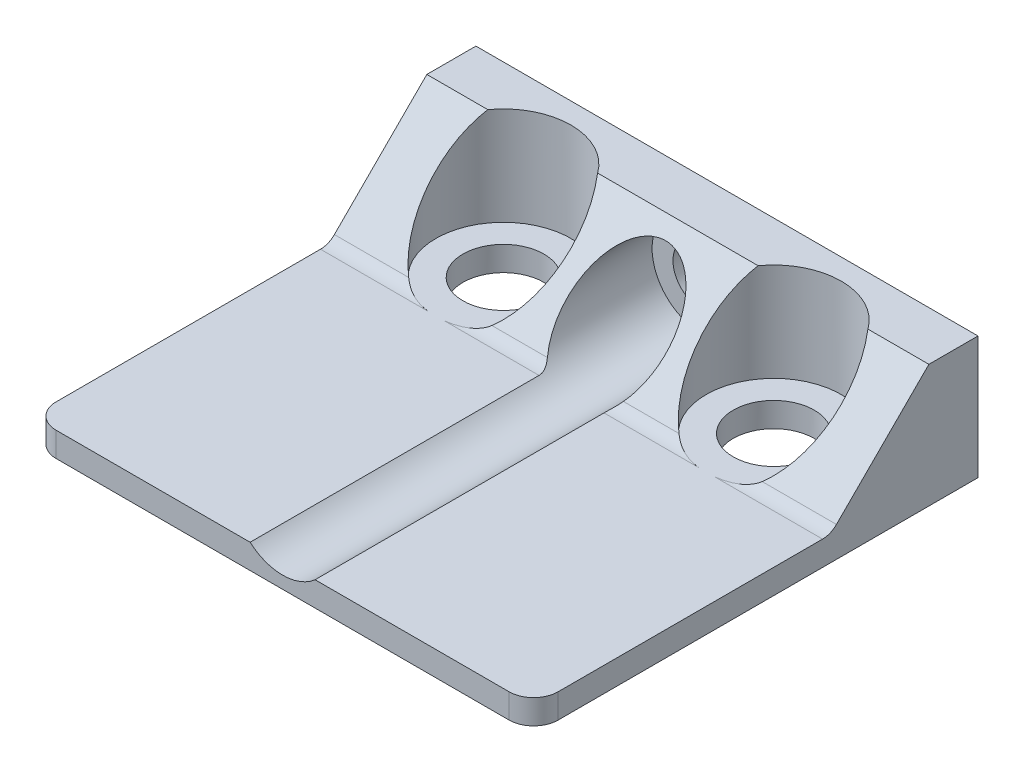
from build123d import *

# Parameters (mm, degrees)
SKETCH1_W                       = 20.45
SKETCH1_H                       = 18.1
BOSS_EXTRUDE2_DEPTH             = 1
BOSS_EXTRUDE3_REACH             = 15.691
BOSS_EXTRUDE3_DIRECTION_2_REACH = 15.691
SKETCH4_R                       = 1.65
CUT_EXTRUDE1_DEPTH              = 5
SKETCH6_R                       = 2.75
CUT_EXTRUDE2_DEPTH              = 4
SKETCH7_R                       = 1.15
CUT_EXTRUDE3_DEPTH              = 9.05
SKETCH8_R                       = 2
CUT_EXTRUDE4_DEPTH              = 8
CUT_EXTRUDE4_DIRECTION_2_REACH  = 16.541
FILLET2_R                       = 1
FILLET3_R                       = 0.8


with BuildPart() as part:
    # Sketch1 → Boss-Extrude2 (new body)
    with BuildSketch(Plane(origin=(0, 0, 0), x_dir=(1, 0, 0), z_dir=(0, 1, 0))):
        Rectangle(SKETCH1_W, SKETCH1_H)
    extrude(amount=BOSS_EXTRUDE2_DEPTH)

    # Boss-Extrude3: up to this face of the body (flat: up to its plane)
    boss_extrude3_end = Plane(part.part.faces().sort_by_distance((10.225, 0.5, 0))[0])
    # Sketch3 → Boss-Extrude3 (add, up to the picked face)
    with BuildSketch(Plane(origin=(0, 0, 0), x_dir=(0, 0, -1), z_dir=(1, 0, 0)), mode=Mode.PRIVATE) as boss_extrude3_sk1:
        Polygon((9.05, 1), (9.05, 5), (7.05, 5), (3.05, 1), align=None)
    boss_extrude3_tool1 = split(extrude(boss_extrude3_sk1.sketch, amount=BOSS_EXTRUDE3_REACH, mode=Mode.PRIVATE), bisect_by=boss_extrude3_end, keep=Keep.BOTH, mode=Mode.PRIVATE)
    add(boss_extrude3_tool1.solids().sort_by(Axis((0, 2.666667, -6.883333), (1, 0, 0)))[0])

    # Boss-Extrude3 direction 2: up to this face of the body (flat: up to its plane)
    boss_extrude3_direction_2_end = Plane(part.part.faces().sort_by_distance((-10.225, 0.5, 0))[0])
    # Sketch3 → Boss-Extrude3 direction 2 (add, up to the picked face)
    with BuildSketch(Plane(origin=(0, 0, 0), x_dir=(0, 0, -1), z_dir=(1, 0, 0)), mode=Mode.PRIVATE) as boss_extrude3_direction_2_sk1:
        Polygon((9.05, 1), (9.05, 5), (7.05, 5), (3.05, 1), align=None)
    boss_extrude3_direction_2_tool1 = split(extrude(boss_extrude3_direction_2_sk1.sketch, amount=-BOSS_EXTRUDE3_DIRECTION_2_REACH, mode=Mode.PRIVATE), bisect_by=boss_extrude3_direction_2_end, keep=Keep.BOTH, mode=Mode.PRIVATE)
    add(boss_extrude3_direction_2_tool1.solids().sort_by(Axis((0, 2.666667, -6.883333), (-1, 0, 0)))[0])

    # Sketch4 → Cut-Extrude1 (cut)
    with BuildSketch(Plane(origin=(0, 5, 0), x_dir=(1, 0, 0), z_dir=(0, 1, 0))):
        with Locations(Location((-5.505, 5.45, 0), (0, 0, 104.141110234))):
            Circle(SKETCH4_R)
        with Locations(Location((5.505, 5.45, 0), (0, 0, 75.858889766))):
            Circle(SKETCH4_R)
    extrude(amount=-CUT_EXTRUDE1_DEPTH, mode=Mode.SUBTRACT)

    # Sketch6 → Cut-Extrude2 (cut)
    with BuildSketch(Plane(origin=(0, 5, 0), x_dir=(1, 0, 0), z_dir=(0, 1, 0))):
        with Locations((-5.505, 5.45)):
            Circle(SKETCH6_R)
        with Locations((5.505, 5.45)):
            Circle(SKETCH6_R)
    extrude(amount=-CUT_EXTRUDE2_DEPTH, mode=Mode.SUBTRACT)

    # Sketch7 → Cut-Extrude3 (cut)
    with BuildSketch(Plane.XY):
        with Locations((0, 2.5)):
            Circle(SKETCH7_R)
    extrude(amount=-CUT_EXTRUDE3_DEPTH, mode=Mode.SUBTRACT)

    # Sketch8 → Cut-Extrude4 (cut)
    with BuildSketch(Plane.XY):
        with Locations(Location((0, 2.5, 0), (0, 0, 228.590377891))):
            Circle(SKETCH8_R)
    extrude(amount=-CUT_EXTRUDE4_DEPTH, mode=Mode.SUBTRACT)

    # Cut-Extrude4 direction 2: up to this face of the body (flat: up to its plane)
    cut_extrude4_direction_2_end = Plane(part.part.faces().sort_by_distance((0, 0.5, 9.05))[0])
    # Sketch8 → Cut-Extrude4 direction 2 (cut, up to the picked face)
    with BuildSketch(Plane.XY, mode=Mode.PRIVATE) as cut_extrude4_direction_2_sk1:
        with Locations(Location((0, 2.5, 0), (0, 0, 228.590377891))):
            Circle(SKETCH8_R)
    cut_extrude4_direction_2_tool1 = split(extrude(cut_extrude4_direction_2_sk1.sketch, amount=CUT_EXTRUDE4_DIRECTION_2_REACH, mode=Mode.PRIVATE), bisect_by=cut_extrude4_direction_2_end, keep=Keep.BOTH, mode=Mode.PRIVATE)
    add(cut_extrude4_direction_2_tool1.solids().sort_by(Axis((0, 2.5, 0), (0, 0, 1)))[0], mode=Mode.SUBTRACT)

    # Fillet2
    fillet2_edges = [part.edges().sort_by_distance(p)[0] for p in [
        (10.225, 0.5, 9.05),
        (-10.225, 0.5, 9.05),
    ]]
    fillet(fillet2_edges, radius=FILLET2_R)

    # Fillet3
    # the kernel refuses this fillet: 0.8 mm, written as the material it adds along each edge
    with BuildSketch(Plane(origin=(-6.019145033, 1, -3.05), x_dir=(0, 0, 1), z_dir=(-1, 0, 0))) as fillet3_piece_1_section:
        with BuildLine():
            CenterArc((FILLET3_R * 0.414213562373, FILLET3_R), FILLET3_R, 225, 45)
            Line((-FILLET3_R * 0.292893218813, FILLET3_R * 0.292893218813), (0, 0))
            Line((0, 0), (FILLET3_R * 0.414213562373, 0))
        make_face()
    fillet3_piece_1 = extrude(amount=4.205854967, mode=Mode.PRIVATE)
    fillet3_piece_1 = fillet3_piece_1 - Plane(origin=(-5.505, 1.04586757, -5.45), x_dir=(1, 0, 0), z_dir=(0, 1, 0)) * Cylinder(2.75, 10, mode=Mode.PRIVATE)
    add(fillet3_piece_1)
    with BuildSketch(Plane(origin=(-0.494448531, 1, -3.05), x_dir=(0, 0, 1), z_dir=(-1, 0, 0))) as fillet3_piece_2_section:
        with BuildLine():
            CenterArc((FILLET3_R * 0.414213562373, FILLET3_R), FILLET3_R, 225, 45)
            Line((-FILLET3_R * 0.292893218813, FILLET3_R * 0.292893218813), (0, 0))
            Line((0, 0), (FILLET3_R * 0.414213562373, 0))
        make_face()
    fillet3_piece_2 = extrude(amount=4.496406436, mode=Mode.PRIVATE)
    fillet3_piece_2 = fillet3_piece_2 - Plane(origin=(-5.505, 1.043873753, -5.45), x_dir=(1, 0, 0), z_dir=(0, 1, 0)) * Cylinder(2.75, 11, mode=Mode.PRIVATE)
    fillet3_piece_2 = fillet3_piece_2 - Plane(origin=(0, 2.5, -3.015215502), x_dir=(-0.6614378277626023, -0.7500000000031267, 0), z_dir=(0, 0, 1)) * Cylinder(2, 11, mode=Mode.PRIVATE)
    add(fillet3_piece_2)
    with BuildSketch(Plane(origin=(4.990854967, 1, -3.05), x_dir=(0, 0.7071067811865468, -0.7071067811865482), z_dir=(-1, 0, 0))) as fillet3_piece_3_section:
        with BuildLine():
            CenterArc((FILLET3_R * 0.414213562373, -FILLET3_R), FILLET3_R, 90, 45)
            Line((-FILLET3_R * 0.292893218813, -FILLET3_R * 0.292893218813), (0, 0))
            Line((0, 0), (FILLET3_R * 0.414213562373, 0))
        make_face()
    fillet3_piece_3 = extrude(amount=4.496406436, mode=Mode.PRIVATE)
    fillet3_piece_3 = fillet3_piece_3 - Plane(origin=(0, 2.5, -3.015215403), x_dir=(-0.6614378277626023, -0.7500000000031267, 0), z_dir=(0, 0, 1)) * Cylinder(2, 11, mode=Mode.PRIVATE)
    fillet3_piece_3 = fillet3_piece_3 - Plane(origin=(5.505, 1.043873896, -5.45), x_dir=(1, 0, 0), z_dir=(0, 1, 0)) * Cylinder(2.75, 11, mode=Mode.PRIVATE)
    add(fillet3_piece_3)
    with BuildSketch(Plane(origin=(10.225, 1, -3.05), x_dir=(0, 0, 1), z_dir=(-1, 0, 0))) as fillet3_piece_4_section:
        with BuildLine():
            CenterArc((FILLET3_R * 0.414213562373, FILLET3_R), FILLET3_R, 225, 45)
            Line((-FILLET3_R * 0.292893218813, FILLET3_R * 0.292893218813), (0, 0))
            Line((0, 0), (FILLET3_R * 0.414213562373, 0))
        make_face()
    fillet3_piece_4 = extrude(amount=4.205854967, mode=Mode.PRIVATE)
    fillet3_piece_4 = fillet3_piece_4 - Plane(origin=(5.505, 1.045867594, -5.45), x_dir=(1, 0, 0), z_dir=(0, 1, 0)) * Cylinder(2.75, 10, mode=Mode.PRIVATE)
    add(fillet3_piece_4)


solid = part.part
